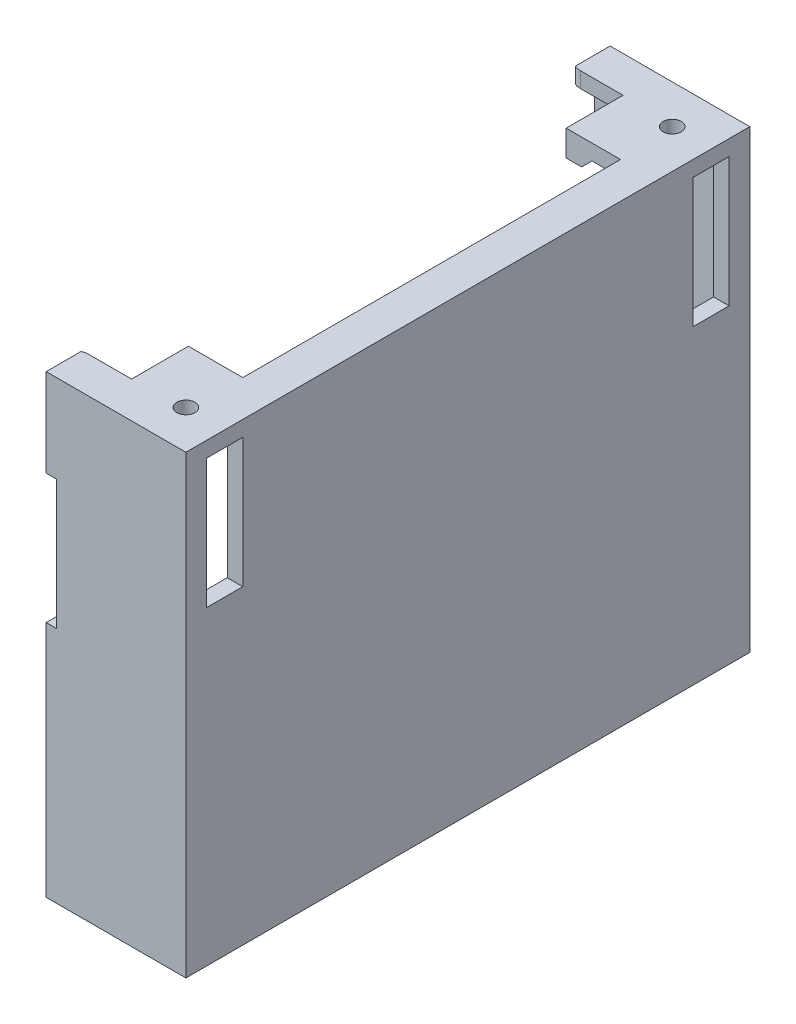
from build123d import *

# Parameters (mm, degrees)
SKETCH1_W           = 57.5
SKETCH1_H           = 109
SKETCH1_R           = 1.75
SKETCH1_W_2         = 28.5
SKETCH1_H_2         = 95
BOSS_EXTRUDE1_DEPTH = 1.5
SKETCH3_W           = 43.5
SKETCH3_H           = 81
CUT_EXTRUDE1_DEPTH  = 3
BOSS_EXTRUDE2_DEPTH = 85
SKETCH5_W           = 145.39083122
SKETCH5_H           = 125.853938275
CUT_EXTRUDE2_DEPTH  = 85
CUT_EXTRUDE3_DEPTH  = 140.802762848
SKETCH8_W           = 103
SKETCH8_H           = 3
BOSS_EXTRUDE3_DEPTH = 25.75
FILLET3_R           = 3
SKETCH13_W          = 109
SKETCH13_H          = 88
CUT_EXTRUDE8_DEPTH  = 1.75
SKETCH14_W          = 2
SKETCH14_H          = 25
CUT_EXTRUDE9_DEPTH  = 5
SKETCH15_W          = 7
SKETCH15_H          = 25
CUT_EXTRUDE10_DEPTH = 106.016665344
SKETCH16_W          = 3
SKETCH16_H          = 15
BOSS_EXTRUDE4_DEPTH = 5
SKETCH17_W          = 7.5
SKETCH17_H          = 4
BOSS_EXTRUDE5_DEPTH = 3
CHAMFER1_SIZE       = 2
SKETCH18_R          = 10
CUT_EXTRUDE11_DEPTH = 10


with BuildPart() as part:
    # Sketch1 → Boss-Extrude1 (new, symmetric)
    with BuildSketch(Plane(origin=(0, 0, 0), x_dir=(1, 0, 0), z_dir=(0, 1, 0))):
        Rectangle(SKETCH1_W, SKETCH1_H)
        with Locations(Location((-21.25, 47, 0), (0, 0, 270))):
            Circle(SKETCH1_R, mode=Mode.SUBTRACT)
        with Locations(Location((21.25, 47, 0), (0, 0, 270))):
            Circle(SKETCH1_R, mode=Mode.SUBTRACT)
        with Locations(Location((21.25, -47, 0), (0, 0, 270))):
            Circle(SKETCH1_R, mode=Mode.SUBTRACT)
        with Locations(Location((-21.25, -47, 0), (0, 0, 270))):
            Circle(SKETCH1_R, mode=Mode.SUBTRACT)
        Rectangle(SKETCH1_W_2, SKETCH1_H_2, mode=Mode.SUBTRACT)
    extrude(amount=BOSS_EXTRUDE1_DEPTH, both=True)

    # Sketch3 → Cut-Extrude1 (cut)
    with BuildSketch(Plane(origin=(0, 1.5, 0), x_dir=(1, 0, 0), z_dir=(0, 1, 0))):
        Rectangle(SKETCH3_W, SKETCH3_H)
    extrude(amount=-CUT_EXTRUDE1_DEPTH, mode=Mode.SUBTRACT)

    # Sketch4 → Boss-Extrude2 (add)
    with BuildSketch(Plane.XZ.offset(1.5)):
        Polygon((28.75, 54.5), (27.30464021, 54.5), (-28.75, 54.5), (-28.75, 51.5), (25.75, 51.5), (25.75, -51.5), (-28.75, -51.5), (-28.75, -54.5), (27.30464021, -54.5), (28.75, -54.5), align=None)
    extrude(amount=BOSS_EXTRUDE2_DEPTH)

    # Sketch5 → Cut-Extrude2 (cut)
    with BuildSketch(Plane(origin=(0, 0, 0), x_dir=(0, 0, -1), z_dir=(1, 0, 0))):
        with Locations((7.269541561, -54.313017537)):
            Rectangle(SKETCH5_W, SKETCH5_H)
    extrude(amount=-CUT_EXTRUDE2_DEPTH, mode=Mode.SUBTRACT)

    # Sketch6 → Cut-Extrude3 (cut, through all)
    with BuildSketch(Plane(origin=(0, 0, 51.5), x_dir=(-1, 0, 0), z_dir=(0, 0, -1))):
        Polygon((0, -6.5), (-20.75, -27.25), (-20.75, -57.75), (0, -78.5), align=None)
    extrude(amount=CUT_EXTRUDE3_DEPTH, mode=Mode.SUBTRACT)

    # Sketch8 → Boss-Extrude3 (add)
    with BuildSketch(Plane.ZY.offset(-25.75)):
        with Locations((0, -85)):
            Rectangle(SKETCH8_W, SKETCH8_H)
    extrude(amount=BOSS_EXTRUDE3_DEPTH)

    # Fillet3
    fillet3_edges = [part.edges().sort_by_distance(p)[0] for p in [
        (0, 0, -47.5),
        (0, 0, 47.5),
        (0, -78.5, -53),
        (20.75, -27.25, -53),
        (0, -6.5, -53),
        (20.75, -57.75, -53),
        (14.25, 0, 47.5),
        (14.25, 0, -47.5),
        (21.75, 0, 40.5),
        (21.75, 0, -40.5),
    ]]
    fillet(fillet3_edges, radius=FILLET3_R)

    # Sketch13 → Cut-Extrude8 (cut)
    with BuildSketch(Plane.ZY):
        with Locations((0, -42.5)):
            Rectangle(SKETCH13_W, SKETCH13_H)
    extrude(amount=-CUT_EXTRUDE8_DEPTH, mode=Mode.SUBTRACT)

    # Sketch14 → Cut-Extrude9 (cut)
    with BuildSketch(Plane.XY.offset(54.5)):
        with Locations((2.75, -28)):
            Rectangle(SKETCH14_W, SKETCH14_H)
    extrude(amount=-CUT_EXTRUDE9_DEPTH, mode=Mode.SUBTRACT)

    # Sketch15 → Cut-Extrude10 (cut, through all)
    with BuildSketch(Plane.ZY.offset(-25.75)):
        with Locations((47, -14)):
            Rectangle(SKETCH15_W, SKETCH15_H)
        with Locations((-47, -14)):
            Rectangle(SKETCH15_W, SKETCH15_H)
    extrude(amount=-CUT_EXTRUDE10_DEPTH, mode=Mode.SUBTRACT)

    # Sketch16 → Boss-Extrude4 (add)
    with BuildSketch(Plane(origin=(0, 1.5, 0), x_dir=(1, 0, 0), z_dir=(0, 1, 0))):
        with Locations((12.75, 44)):
            Rectangle(SKETCH16_W, SKETCH16_H)
        with Locations((12.75, -44)):
            Rectangle(SKETCH16_W, SKETCH16_H)
    extrude(amount=-BOSS_EXTRUDE4_DEPTH)

    # Sketch17 → Boss-Extrude5 (add)
    with BuildSketch(Plane(origin=(0, 1.5, 0), x_dir=(1, 0, 0), z_dir=(0, 1, 0))):
        with Locations((18, 38.5)):
            Rectangle(SKETCH17_W, SKETCH17_H)
        with Locations((18, -38.5)):
            Rectangle(SKETCH17_W, SKETCH17_H)
    extrude(amount=-BOSS_EXTRUDE5_DEPTH)

    # Chamfer1
    chamfer1_edges = [part.edges().sort_by_distance(p)[0] for p in [
        (14.25, -1.5, 44),
        (14.25, -1.5, -44),
    ]]
    chamfer(chamfer1_edges, length=CHAMFER1_SIZE - 0.0001)  # a hair under: the kernel refuses the full size

    # Sketch18 → Cut-Extrude11 (cut)
    with BuildSketch(Plane.XZ.offset(86.5)):
        with Locations((1.75, 34.5)):
            Circle(SKETCH18_R)
    extrude(amount=-CUT_EXTRUDE11_DEPTH, mode=Mode.SUBTRACT)


solid = part.part
